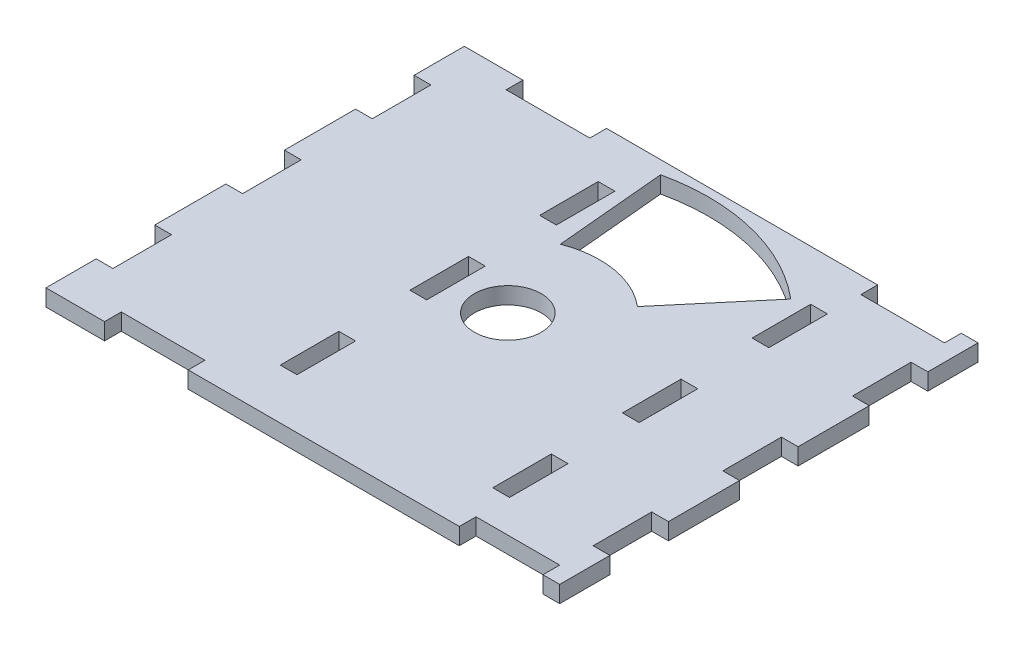
from build123d import *

# Parameters (mm, degrees)
SKETCH2_W           = 100
SKETCH2_H           = 50
SKETCH2_R           = 4
BOSS_EXTRUDE1_DEPTH = 2
SKETCH5_W           = 2
SKETCH5_H           = 7
CUT_EXTRUDE3_DEPTH  = 2
CUT_EXTRUDE6_DEPTH  = 2
SKETCH11_W          = 5
SKETCH11_H          = 2
CUT_EXTRUDE7_DEPTH  = 2
SKETCH12_W          = 9.8
SKETCH12_H          = 50
SKETCH12_W_2        = 8.8
CUT_EXTRUDE8_DEPTH  = 6
SKETCH13_W          = 5
SKETCH13_H          = 2
CUT_EXTRUDE10_DEPTH = 6


with BuildPart() as part:
    # Sketch2 → Boss-Extrude1 (new body)
    with BuildSketch(Plane(origin=(0, 0, 0), x_dir=(1, 0, 0), z_dir=(0, 1, 0))):
        Rectangle(SKETCH2_W, SKETCH2_H)
        Circle(SKETCH2_R, mode=Mode.SUBTRACT)
    extrude(amount=BOSS_EXTRUDE1_DEPTH)

    # Sketch5 → Cut-Extrude3 (cut)
    with BuildSketch(Plane(origin=(0, 0, 0), x_dir=(-1, 0, 0), z_dir=(0, -1, 0))):
        with Locations((-18.2, -15.5)):
            Rectangle(SKETCH5_W, SKETCH5_H)
        with Locations((-18.2, 0)):
            Rectangle(SKETCH5_W, SKETCH5_H)
        with Locations((-18.2, 15.5)):
            Rectangle(SKETCH5_W, SKETCH5_H)
        with Locations((7.2, 15.5)):
            Rectangle(SKETCH5_W, SKETCH5_H)
        with Locations((7.2, 0)):
            Rectangle(SKETCH5_W, SKETCH5_H)
        with Locations((7.2, -15.5)):
            Rectangle(SKETCH5_W, SKETCH5_H)
    extrude(amount=-CUT_EXTRUDE3_DEPTH, mode=Mode.SUBTRACT)

    # Sketch10 → Cut-Extrude6 (cut)
    with BuildSketch(Plane(origin=(0, 2, 0), x_dir=(1, 0, 0), z_dir=(0, 1, 0))):
        with BuildLine():
            ThreePointArc((15.473926709, 18.345506049), (5.745726742, 23.302073389), (-5.171573663, 23.436186248))
            Line((-5.171573663, 23.436186248), (-3.975341771, 10.256542195))
            ThreePointArc((-3.975341771, 10.256542195), (1.811815129, 10.849761561), (7.092216408, 8.408356939))
            Line((7.092216408, 8.408356939), (15.473926709, 18.345506049))
        make_face()
    extrude(amount=-CUT_EXTRUDE6_DEPTH, mode=Mode.SUBTRACT)

    # Sketch11 → Cut-Extrude7 (cut)
    with BuildSketch(Plane(origin=(0, 2, 0), x_dir=(1, 0, 0), z_dir=(0, 1, 0))):
        with Locations((-15.7, -24)):
            Rectangle(SKETCH11_W, SKETCH11_H)
        with Locations((26.7, -24)):
            Rectangle(SKETCH11_W, SKETCH11_H)
        with Locations((26.7, 24)):
            Rectangle(SKETCH11_W, SKETCH11_H)
        with Locations((-15.7, 24)):
            Rectangle(SKETCH11_W, SKETCH11_H)
    extrude(amount=-CUT_EXTRUDE7_DEPTH, mode=Mode.SUBTRACT)

    # Sketch12 → Cut-Extrude8 (cut)
    with BuildSketch(Plane(origin=(0, 2, 0), x_dir=(1, 0, 0), z_dir=(0, 1, 0))):
        with Locations((-45.1, 0)):
            Rectangle(SKETCH12_W, SKETCH12_H)
        with Locations((45.6, 0)):
            Rectangle(SKETCH12_W_2, SKETCH12_H)
    extrude(amount=-CUT_EXTRUDE8_DEPTH, mode=Mode.SUBTRACT)

    # Sketch13 → Cut-Extrude10 (cut)
    with BuildSketch(Plane(origin=(0, 2, 0), x_dir=(1, 0, 0), z_dir=(0, 1, 0))):
        Polygon((-28.2, 12), (-28.2, 19), (-30.2, 19), (-30.2, 25), (-40.2, 25), (-40.2, -25), (-30.2, -25), (-30.2, -19), (-28.2, -19), (-28.2, -12), (-30.2, -12), (-30.2, -3.5), (-28.2, -3.5), (-28.2, 3.5), (-30.2, 3.5), (-30.2, 12), align=None)
        with Locations((-20.7, -24)):
            Rectangle(SKETCH13_W, SKETCH13_H)
        with Locations((-20.7, 24)):
            Rectangle(SKETCH13_W, SKETCH13_H)
        Polygon((31.2, 19), (29.2, 19), (29.2, 12), (31.2, 12), (31.2, 3.5), (29.2, 3.5), (29.2, -3.5), (31.2, -3.5), (31.2, -12), (29.2, -12), (29.2, -19), (31.2, -19), (31.2, -25), (41.2, -25), (41.2, 25), (31.2, 25), align=None)
        with Locations((21.7, -24)):
            Rectangle(SKETCH13_W, SKETCH13_H)
        with Locations((21.7, 24)):
            Rectangle(SKETCH13_W, SKETCH13_H)
    extrude(amount=-CUT_EXTRUDE10_DEPTH, mode=Mode.SUBTRACT)


solid = part.part
